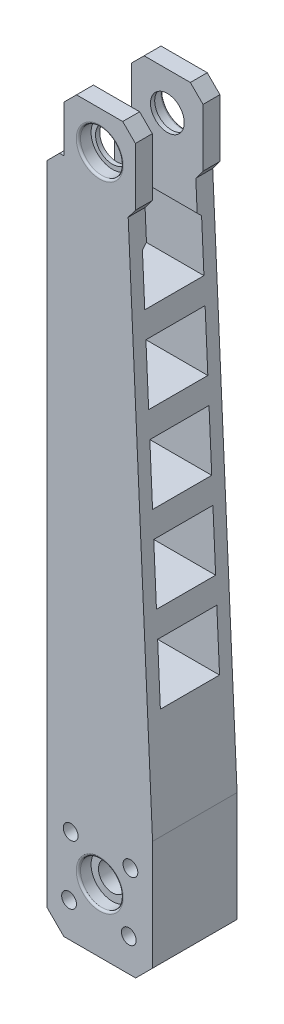
from build123d import *
from OCP.BRepFilletAPI import BRepFilletAPI_MakeChamfer

# Parameters (mm, degrees)
SKETCH_1_R          = 1.75
EXTRUDE_1_DEPTH     = 20
CHAMFER_1_SIZE      = 4
SKETCH_2_R          = 5.05
CUT_EXTRUDE_1_DEPTH = 3
SKETCH_3_R          = 3.3
CUT_EXTRUDE_2_DEPTH = 32
CUT_EXTRUDE_START   = -3
SKETCH_4_R          = 5.05
CUT_EXTRUDE_3_DEPTH = 3
CHAMFER_2_SIZE      = 3
CHAMFER_2_SIZE2     = 3.148509384
SKETCH_6_W          = 14
SKETCH_6_H          = 14
CUT_EXTRUDE_4_DEPTH = 58
EXTRUDE_2_DEPTH     = 4
SKETCH_8_R          = 5.05
CUT_EXTRUDE_5_DEPTH = 3
SKETCH_9_R          = 4
CUT_EXTRUDE_6_DEPTH = 3
CHAMFER_3_SIZE      = 3
CHAMFER_4_SIZE      = 3
CHAMFER_5_SIZE      = 2
FILLET_1_R          = 0.5
FILLET_2_R          = 0.5
FILLET_3_R          = 0.5


with BuildPart() as part:
    # 草图1 → 凸台-拉伸1 (new body)
    with BuildSketch(Plane.XY):
        Polygon((12.5, -50), (6.5, 80), (-12.5, 80), (-12.5, -80), (12.5, -80), align=None)
        with Locations((-6.881060168, -57.743898363)):
            Circle(SKETCH_1_R, mode=Mode.SUBTRACT)
        with Locations((7.256101637, -58.118939832)):
            Circle(SKETCH_1_R, mode=Mode.SUBTRACT)
        with Locations((6.881060168, -72.256101637)):
            Circle(SKETCH_1_R, mode=Mode.SUBTRACT)
        with Locations((-7.256101637, -71.881060168)):
            Circle(SKETCH_1_R, mode=Mode.SUBTRACT)
    extrude(amount=EXTRUDE_1_DEPTH)

    # 倒角1
    chamfer_1_edges = [part.edges().sort_by_distance(p)[0] for p in [
        (12.5, -80, 10),
        (-12.5, -80, 10),
    ]]
    chamfer(chamfer_1_edges, length=CHAMFER_1_SIZE)

    # 草图2 → 切除-拉伸1 (cut)
    with BuildSketch(Plane.XY.offset(20)):
        with Locations((0, -65)):
            Circle(SKETCH_2_R)
    extrude(amount=-CUT_EXTRUDE_1_DEPTH, mode=Mode.SUBTRACT)

    # 草图3 → 切除-拉伸2 (cut)
    with BuildSketch(Plane(origin=(0, 0, 0), x_dir=(-1, 0, 0), z_dir=(0, 0, -1))):
        with Locations((0, -65)):
            Circle(SKETCH_3_R)
    extrude(amount=-CUT_EXTRUDE_2_DEPTH, mode=Mode.SUBTRACT)

    # 草图4 → 切除-拉伸3 (cut)
    with BuildSketch(Plane(origin=(0, 0, 0), x_dir=(-1, 0, 0), z_dir=(0, 0, -1)).offset(CUT_EXTRUDE_START)):
        with Locations(Location((0, -65, 0), (0, 0, 180))):
            Circle(SKETCH_4_R)
    extrude(amount=CUT_EXTRUDE_3_DEPTH, mode=Mode.SUBTRACT)

    # 倒角2: one chamfer whose edges measure the first distance from different faces: ONE call of the kernel's chamfer builder (chamfer() names one face for all edges)
    chamfer_2_edges_1 = [part.edges().sort_by_distance(p)[0] for p in [
        (-12.5, 80, 10),
    ]]
    chamfer_2_edges_2 = [part.edges().sort_by_distance(p)[0] for p in [
        (6.5, 80, 10),
    ]]
    chamfer_2_side_2 = [part.faces().sort_by_distance(p)[0] for p in [
        (9.5, 15, 10),
    ]]
    chamfer_2 = BRepFilletAPI_MakeChamfer(part.part.solid().wrapped)
    for e in chamfer_2_edges_1:
        chamfer_2.Add(CHAMFER_2_SIZE, e.wrapped)
    for e in chamfer_2_edges_2:
        chamfer_2.Add(CHAMFER_2_SIZE, CHAMFER_2_SIZE2, e.wrapped, chamfer_2_side_2[0].wrapped)  # the first distance lies on this face
    add(Compound.cast(chamfer_2.Shape()), mode=Mode.REPLACE)

    # 草图6 → 切除-拉伸4 (cut)
    with BuildSketch(Plane.ZY.offset(12.5)):
        Polygon((3, 69), (4, 69), (4, 86.606833076), (16, 86.606833076), (16, 69), (17, 69), (17, 55), (3, 55), align=None)
        with Locations((10, 42)):
            Rectangle(SKETCH_6_W, SKETCH_6_H)
        with Locations((10, 22)):
            Rectangle(SKETCH_6_W, SKETCH_6_H)
        with Locations((10, 2)):
            Rectangle(SKETCH_6_W, SKETCH_6_H)
        with Locations((10, -18)):
            Rectangle(SKETCH_6_W, SKETCH_6_H)
    extrude(amount=-CUT_EXTRUDE_4_DEPTH, mode=Mode.SUBTRACT)

    # 草图7 → 凸台-拉伸2 (add)
    with BuildSketch(Plane(origin=(0, 0, 0), x_dir=(-1, 0, 0), z_dir=(0, 0, -1))):
        Polygon((8.5, 93.975326294), (-4.475326294, 93.975326294), (-6.6383143, 93.975326294), (-8.4383143, 93.975326294), (-8.4383143, 77.287576761), (-6.730769231, 75), (-6.6383143, 77.00319017), (-4.475326294, 78.975326294), (-3.351490616, 80), (8.5, 80), align=None)
    extrude_2 = extrude(amount=-EXTRUDE_2_DEPTH)

    # 镜向1: 凸台-拉伸2 across plane
    add(extrude_2.mirror(Plane.XY.offset(10)))

    # 草图8 → 切除-拉伸5 (cut)
    with BuildSketch(Plane(origin=(0, 0, 0), x_dir=(-1, 0, 0), z_dir=(0, 0, -1))):
        with Locations((0, 85)):
            Circle(SKETCH_8_R)
    cut_extrude_5 = extrude(amount=-CUT_EXTRUDE_5_DEPTH, mode=Mode.SUBTRACT)

    # 草图9 → 切除-拉伸6 (cut)
    with BuildSketch(Plane(origin=(0, 0, 3), x_dir=(-1, 0, 0), z_dir=(0, 0, -1))):
        with Locations((0, 85)):
            Circle(SKETCH_9_R)
    cut_extrude_6 = extrude(amount=-CUT_EXTRUDE_6_DEPTH, mode=Mode.SUBTRACT)

    # 镜向2: 切除-拉伸5, 切除-拉伸6 across plane
    add(cut_extrude_5.mirror(Plane.XY.offset(10)), mode=Mode.SUBTRACT)
    add(cut_extrude_6.mirror(Plane.XY.offset(10)), mode=Mode.SUBTRACT)

    # 倒角3
    chamfer_3_edges = [part.edges().sort_by_distance(p)[0] for p in [
        (8.4383143, 93.975326294, 2),
        (-8.5, 93.975326294, 2),
    ]]
    chamfer(chamfer_3_edges, length=CHAMFER_3_SIZE)

    # 倒角4
    chamfer_4_edges = [part.edges().sort_by_distance(p)[0] for p in [
        (-8.5, 93.975326294, 18),
        (8.4383143, 93.975326294, 18),
    ]]
    chamfer(chamfer_4_edges, length=CHAMFER_4_SIZE)

    # 倒角5
    # the kernel refuses this chamfer: 2 mm, written as the material it adds along each edge
    with BuildSketch(Plane(origin=(-12.5, 69, 3), x_dir=(0, -0.9996219169112968, -0.0274958766105862), z_dir=(1, 0, 0))) as chamfer_5_piece_1_section:
        Polygon((CHAMFER_5_SIZE * 0.999621916911, -CHAMFER_5_SIZE * 0.0274958766106), (-CHAMFER_5_SIZE * 0.0274958766106, -CHAMFER_5_SIZE * 0.999621916911), (0, 0), align=None)
    chamfer_5_piece_1 = extrude(amount=24.651058284, mode=Mode.PRIVATE)
    chamfer_5_piece_1 = split(chamfer_5_piece_1, bisect_by=Plane(origin=(7.023262374, 68.662648572, 3.416350106), z_dir=(-0.9989366098486855, -0.04610476660840088, 0)), keep=Keep.TOP, mode=Mode.PRIVATE)
    chamfer_5_piece_1 = split(chamfer_5_piece_1, bisect_by=Plane(origin=(-2.727982872, 68.212591099, 4), z_dir=(0, 0, -1)), keep=Keep.TOP, mode=Mode.PRIVATE)
    add(chamfer_5_piece_1)
    with BuildSketch(Plane(origin=(-12.5, 69, 17), x_dir=(0, 0.02749587661058907, -0.9996219169112965), z_dir=(1, 0, 0))) as chamfer_5_piece_2_section:
        Polygon((CHAMFER_5_SIZE * 0.999621916911, -CHAMFER_5_SIZE * 0.0274958766106), (-CHAMFER_5_SIZE * 0.0274958766106, -CHAMFER_5_SIZE * 0.999621916911), (0, 0), align=None)
    chamfer_5_piece_2 = extrude(amount=24.651058284, mode=Mode.PRIVATE)
    chamfer_5_piece_2 = split(chamfer_5_piece_2, bisect_by=Plane(origin=(7.023262374, 68.662648572, 16.583649894), z_dir=(-0.9989366098486855, -0.04610476660840088, 0)), keep=Keep.TOP, mode=Mode.PRIVATE)
    chamfer_5_piece_2 = split(chamfer_5_piece_2, bisect_by=Plane(origin=(-2.727982872, 68.212591099, 16), z_dir=(0, 0, 1)), keep=Keep.TOP, mode=Mode.PRIVATE)
    add(chamfer_5_piece_2)

    # 圆角1
    fillet_1_edges = [part.edges().sort_by_distance(p)[0] for p in [
        (-5.05, -65, 0),
    ]]
    fillet(fillet_1_edges, radius=FILLET_1_R)

    # 圆角2
    fillet_2_edges = [part.edges().sort_by_distance(p)[0] for p in [
        (-5.05, -65, 20),
    ]]
    fillet(fillet_2_edges, radius=FILLET_2_R)

    # 圆角3
    fillet_3_edges = [part.edges().sort_by_distance(p)[0] for p in [
        (5.05, 85, 0),
        (5.05, 85, 20),
    ]]
    fillet(fillet_3_edges, radius=FILLET_3_R)


solid = part.part
